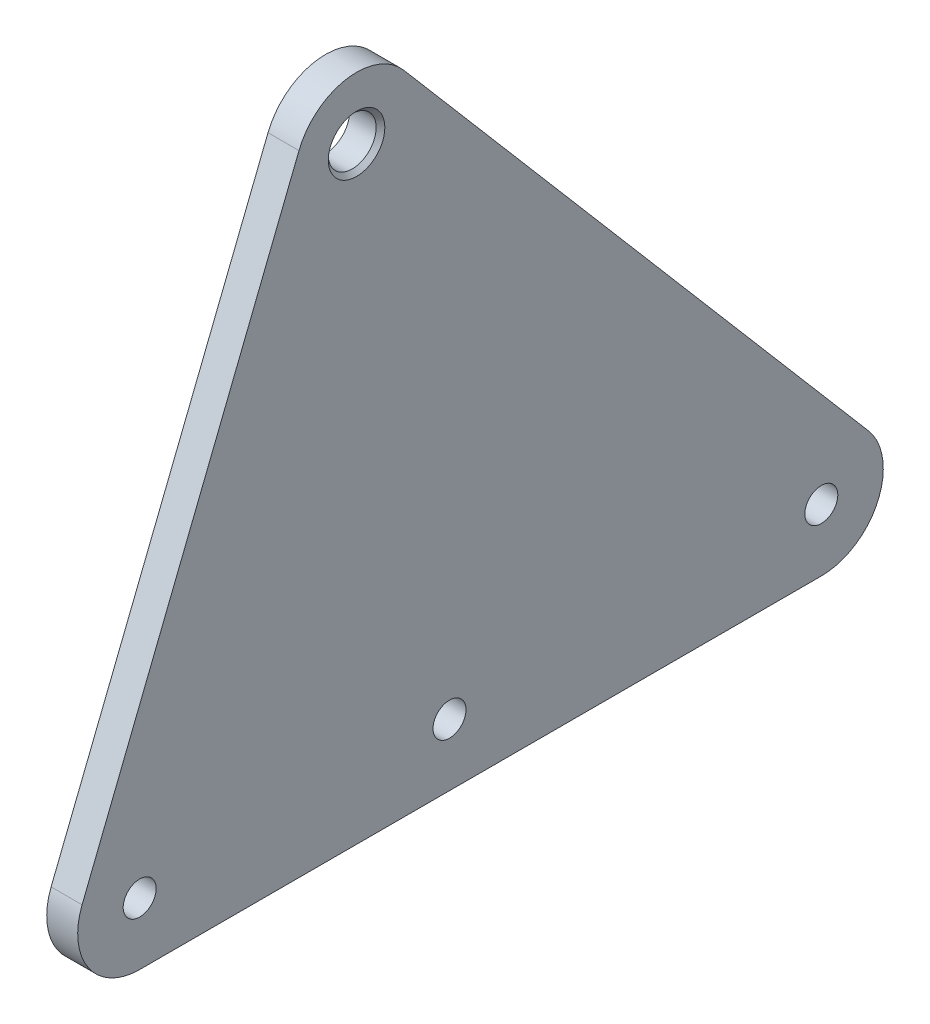
from build123d import *

# Parameters (mm, degrees)
BOSS_EXTRUDE1_DEPTH               = 6.35
CUT_EXTRUDE1_REACH                = 166.779
SKETCH2_R                         = 3.3782
F_3_8_CLEARANCE_HOLE1_D           = 9.8044
F_3_8_CLEARANCE_HOLE1_CSINK_D     = 11.58748
F_3_8_CLEARANCE_HOLE1_CSINK_ANGLE = 90


with BuildPart() as part:
    # Sketch1 → Boss-Extrude1 (new body)
    with BuildSketch(Plane(origin=(0, 0, 0), x_dir=(0, 0, -1), z_dir=(1, 0, 0))):
        with BuildLine():
            Line((-56.249045375, -106.934859066), (-11.799045375, 4.698140934))
            ThreePointArc((-11.799045375, 4.698140934), (-2.069950001, 12.530175856), (9.661154553, 8.243305933))
            Line((9.661154553, 8.243305933), (104.911154553, -103.389694067))
            ThreePointArc((104.911154553, -103.389694067), (106.782128714, -116.95277512), (95.25, -124.333))
            Line((95.25, -124.333), (-44.45, -124.333))
            ThreePointArc((-44.45, -124.333), (-54.960860808, -118.76123997), (-56.249045375, -106.934859066))
        make_face()
    extrude(amount=BOSS_EXTRUDE1_DEPTH)

    # Sketch2 → Cut-Extrude1 (cut, up to next)
    with BuildSketch(Plane(origin=(6.35, 0, 0), x_dir=(0, 0, -1), z_dir=(1, 0, 0)), mode=Mode.PRIVATE) as cut_extrude1_sk1:
        with Locations((-44.45, -111.633)):
            Circle(SKETCH2_R)
    cut_extrude1_tool1 = extrude(cut_extrude1_sk1.sketch, amount=-CUT_EXTRUDE1_REACH, mode=Mode.PRIVATE) & part.part
    # Sketch2 → Cut-Extrude1 (cut, up to next)
    with BuildSketch(Plane(origin=(6.35, 0, 0), x_dir=(0, 0, -1), z_dir=(1, 0, 0)), mode=Mode.PRIVATE) as cut_extrude1_sk2:
        with Locations((19.05, -111.633)):
            Circle(SKETCH2_R)
    cut_extrude1_tool2 = extrude(cut_extrude1_sk2.sketch, amount=-CUT_EXTRUDE1_REACH, mode=Mode.PRIVATE) & part.part
    # Sketch2 → Cut-Extrude1 (cut, up to next)
    with BuildSketch(Plane(origin=(6.35, 0, 0), x_dir=(0, 0, -1), z_dir=(1, 0, 0)), mode=Mode.PRIVATE) as cut_extrude1_sk3:
        with Locations((95.25, -111.633)):
            Circle(SKETCH2_R)
    cut_extrude1_tool3 = extrude(cut_extrude1_sk3.sketch, amount=-CUT_EXTRUDE1_REACH, mode=Mode.PRIVATE) & part.part
    add(cut_extrude1_tool1.solids().sort_by_distance((6.35, -111.633, 44.45))[0], mode=Mode.SUBTRACT)
    add(cut_extrude1_tool2.solids().sort_by_distance((6.35, -111.633, -19.05))[0], mode=Mode.SUBTRACT)
    add(cut_extrude1_tool3.solids().sort_by_distance((6.35, -111.633, -95.25))[0], mode=Mode.SUBTRACT)

    # 3/8 Clearance Hole1 (through all)
    with Locations(Plane(origin=(6.35, 0, 0), x_dir=(0, 0, -1), z_dir=(1, 0, 0))):
        with Locations((0, 0)):
            CounterSinkHole(F_3_8_CLEARANCE_HOLE1_D / 2, F_3_8_CLEARANCE_HOLE1_CSINK_D / 2, counter_sink_angle=F_3_8_CLEARANCE_HOLE1_CSINK_ANGLE)


solid = part.part
